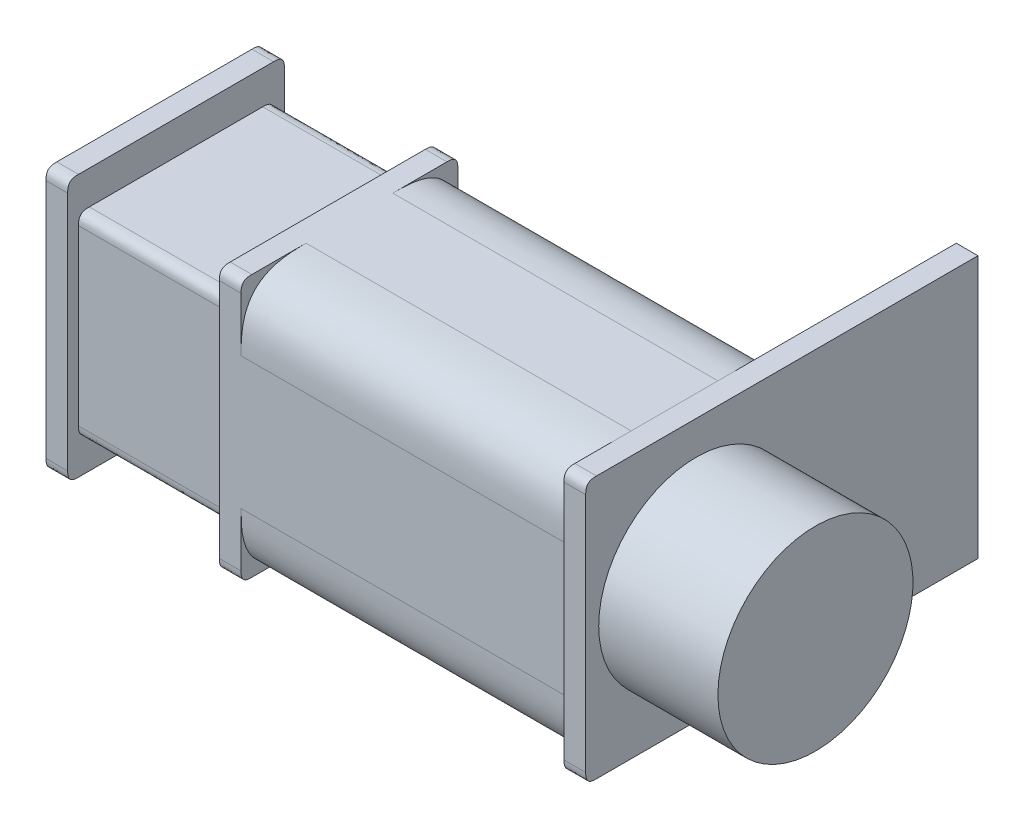
from build123d import *

# Parameters (mm, degrees)
BOSS_EXTRUDE1_DEPTH        = 5
BOSS_EXTRUDE1_DEPTH_BACK   = 5
SKETCH1_W                  = 1
SKETCH1_H                  = 12.1
BOSS_EXTRUDE1_2_DEPTH      = 5
BOSS_EXTRUDE1_2_DEPTH_BACK = 5
SKETCH1_W_2                = 15
FILLET1_START              = 9
FILLET1_OUTLINE_W          = 16
FILLET1_OUTLINE_H          = 14
FILLET1_DEPTH              = 17
FILLET2_SIZE               = 0.5
BOSS_EXTRUDE5_DEPTH        = 5
BOSS_EXTRUDE5_DEPTH_BACK   = 5
FILLET3_SIZE               = 0.5
BOSS_EXTRUDE3_START        = -4.5
BOSS_EXTRUDE3_OUTLINE_W    = 7
BOSS_EXTRUDE3_OUTLINE_H    = 9
BOSS_EXTRUDE3_DEPTH        = 9
FILLET5_SIZE               = 0.5
BOSS_EXTRUDE4_DEPTH        = 5.1
BOSS_EXTRUDE4_DEPTH_BACK   = 13
SKETCH1_5_W                = 1
SKETCH1_5_H                = 12.1
FILLET4_SIZE               = 0.5
SKETCH1_8_W                = 5.5
SKETCH1_8_H                = 4.5
SKETCH1_12_W               = 0.7
SKETCH1_12_H               = 0.5


with BuildPart() as part:
    # Sketch1 → Boss-Extrude1 (new, two sides: drawn at the far end of the back side and taken through both)
    with BuildSketch(Plane.XY.offset(-BOSS_EXTRUDE1_DEPTH_BACK)):
        with Locations((1.2, 0)):
            Rectangle(SKETCH1_W, SKETCH1_H)
    extrude(amount=BOSS_EXTRUDE1_DEPTH + BOSS_EXTRUDE1_DEPTH_BACK)

    # Fillet2
    # a fillet whose section is not a circle: 0.5 mm, written as the material it takes off along each edge
    with BuildSketch(Plane(origin=(2.95, 6.05, 5), x_dir=(0, 0, -1), z_dir=(-1, 0, 0)), Plane(origin=(2.95, 6.05, -5), x_dir=(0, -1, 0), z_dir=(-1, 0, 0)), Plane(origin=(-0.55, -6.05, 5), x_dir=(0, 0, -1), z_dir=(1, 0, 0))) as fillet2_piece_1:
        with BuildLine():
            add(Edge.make_bspline([(FILLET2_SIZE, 0), (FILLET2_SIZE * 0.831801948466, 0), (FILLET2_SIZE * 0.663603896932, 0), (FILLET2_SIZE * 0.292893218813, FILLET2_SIZE * 0.0716919198361), (FILLET2_SIZE * 0.0716919198361, FILLET2_SIZE * 0.292893218813), (0, FILLET2_SIZE * 0.663603896932), (0, FILLET2_SIZE * 0.831801948466), (0, FILLET2_SIZE)], knots=[0, 0, 0, 0, 0, 0, 0.5, 0.5, 1, 1, 1, 1, 1, 1], degree=5))
            Line((0, FILLET2_SIZE), (0, 0))
            Line((0, 0), (FILLET2_SIZE, 0))
        make_face()
    extrude(amount=3.5, mode=Mode.SUBTRACT)
    with BuildSketch(Plane(origin=(-0.55, -6.05, -5), x_dir=(0, 0, 1), z_dir=(1, 0, 0))) as fillet2_piece_2:
        with BuildLine():
            add(Edge.make_bspline([(FILLET2_SIZE, 0), (FILLET2_SIZE * 0.831801948466, 0), (FILLET2_SIZE * 0.663603896932, 0), (FILLET2_SIZE * 0.292893218813, -FILLET2_SIZE * 0.0716919198361), (FILLET2_SIZE * 0.0716919198361, -FILLET2_SIZE * 0.292893218813), (0, -FILLET2_SIZE * 0.663603896932), (0, -FILLET2_SIZE * 0.831801948466), (0, -FILLET2_SIZE)], knots=[0, 0, 0, 0, 0, 0, 0.5, 0.5, 1, 1, 1, 1, 1, 1], degree=5))
            Line((0, -FILLET2_SIZE), (0, 0))
            Line((0, 0), (FILLET2_SIZE, 0))
        make_face()
    extrude(amount=3.5, mode=Mode.SUBTRACT)

    # Boss-Extrude3: read off the stored shape, not the designer's step
    # Boss-Extrude3 outline → Boss-Extrude3 (add)
    with BuildSketch(Plane.XY.offset(BOSS_EXTRUDE3_START)):
        with Locations((5.2, 0)):
            Rectangle(BOSS_EXTRUDE3_OUTLINE_W, BOSS_EXTRUDE3_OUTLINE_H)
    extrude(amount=BOSS_EXTRUDE3_DEPTH)

    # Fillet5
    # a fillet whose section is not a circle: 0.5 mm, written as the material it takes off along each edge
    with BuildSketch(Plane(origin=(9.95, 4.5, -4.5), x_dir=(0, -1, 0), z_dir=(-1, 0, 0)), Plane(origin=(1.7, -4.5, -4.5), x_dir=(0, 1, 0), z_dir=(1, 0, 0)), Plane(origin=(1.7, -4.5, 4.5), x_dir=(0, 0, -1), z_dir=(1, 0, 0))) as fillet5_piece_1:
        with BuildLine():
            add(Edge.make_bspline([(FILLET5_SIZE, 0), (FILLET5_SIZE * 0.831801948466, 0), (FILLET5_SIZE * 0.663603896932, 0), (FILLET5_SIZE * 0.292893218813, FILLET5_SIZE * 0.0716919198361), (FILLET5_SIZE * 0.0716919198361, FILLET5_SIZE * 0.292893218813), (0, FILLET5_SIZE * 0.663603896932), (0, FILLET5_SIZE * 0.831801948466), (0, FILLET5_SIZE)], knots=[0, 0, 0, 0, 0, 0, 0.5, 0.5, 1, 1, 1, 1, 1, 1], degree=5))
            Line((0, FILLET5_SIZE), (0, 0))
            Line((0, 0), (FILLET5_SIZE, 0))
        make_face()
    extrude(amount=8.25, mode=Mode.SUBTRACT)
    with BuildSketch(Plane(origin=(9.95, 4.5, 4.5), x_dir=(0, -1, 0), z_dir=(-1, 0, 0))) as fillet5_piece_2:
        with BuildLine():
            add(Edge.make_bspline([(FILLET5_SIZE, 0), (FILLET5_SIZE * 0.831801948466, 0), (FILLET5_SIZE * 0.663603896932, 0), (FILLET5_SIZE * 0.292893218813, -FILLET5_SIZE * 0.0716919198361), (FILLET5_SIZE * 0.0716919198361, -FILLET5_SIZE * 0.292893218813), (0, -FILLET5_SIZE * 0.663603896932), (0, -FILLET5_SIZE * 0.831801948466), (0, -FILLET5_SIZE)], knots=[0, 0, 0, 0, 0, 0, 0.5, 0.5, 1, 1, 1, 1, 1, 1], degree=5))
            Line((0, -FILLET5_SIZE), (0, 0))
            Line((0, 0), (FILLET5_SIZE, 0))
        make_face()
    extrude(amount=8.25, mode=Mode.SUBTRACT)

    # Sketch1<12> → Revolve3 (revolve)
    with BuildSketch(Plane.XY, mode=Mode.PRIVATE) as revolve3_sk:
        with Locations((0.35, 2.25)):
            Rectangle(SKETCH1_12_W, SKETCH1_12_H)
    revolve(revolve3_sk.sketch.rotate(Axis((0, 0, 0), (1, 0, 0)), 90), axis=Axis((0, 0, 0), (1, 0, 0)))


with BuildPart() as body_2:
    # Sketch1 → Boss-Extrude1 2 (new, two sides: drawn at the far end of the back side and taken through both)
    with BuildSketch(Plane.XY.offset(-BOSS_EXTRUDE1_2_DEPTH_BACK)):
        with Locations((17.2, 0)):
            Rectangle(SKETCH1_W_2, SKETCH1_H)
    extrude(amount=BOSS_EXTRUDE1_2_DEPTH + BOSS_EXTRUDE1_2_DEPTH_BACK)

    # Fillet1: read off the stored shape, not the designer's step
    # Fillet1 outline → Fillet1 (cut)
    # profile 1 of 3: a face of its own
    with BuildSketch(Plane.YZ.offset(FILLET1_START)):
        Rectangle(FILLET1_OUTLINE_W, FILLET1_OUTLINE_H)
        with BuildLine():
            Line((3.05, -5), (-3.05, -5))
            Line((-3.05, -5), (-6.05, -5))
            Line((-6.05, -5), (-6.05, -2))
            Line((-6.05, -2), (-6.05, 2))
            Line((-6.05, 2), (-6.05, 5))
            Line((-6.05, 5), (-3.05, 5))
            Line((-3.05, 5), (3.05, 5))
            add(Edge.make_bspline(
                [(3.05, 5), (3.554594155, 5), (4.059188309, 5), (5.171320344, 4.78492424), (5.83492424, 4.121320344), (6.05, 3.009188309), (6.05, 2.504594155), (6.05, 2)],
                knots=[0, 0, 0, 0, 0, 0, 0.5, 0.5, 1, 1, 1, 1, 1, 1], degree=5))
            Line((6.05, 2), (6.05, -2))
            add(Edge.make_bspline(
                [(3.05, -5), (3.554594155, -5), (4.059188309, -5), (5.171320344, -4.78492424), (5.83492424, -4.121320344), (6.05, -3.009188309), (6.05, -2.504594155), (6.05, -2)],
                knots=[0, 0, 0, 0, 0, 0, 0.5, 0.5, 1, 1, 1, 1, 1, 1], degree=5))
        make_face(mode=Mode.SUBTRACT)
    # profile 2 of 3: a face of its own
    with BuildSketch(Plane.YZ.offset(FILLET1_START)):
        with BuildLine():
            Line((-6.05, 5), (-6.05, 2))
            add(Edge.make_bspline(
                [(-3.05, 5), (-3.554594155, 5), (-4.059188309, 5), (-5.171320344, 4.78492424), (-5.83492424, 4.121320344), (-6.05, 3.009188309), (-6.05, 2.504594155), (-6.05, 2)],
                knots=[0, 0, 0, 0, 0, 0, 0.5, 0.5, 1, 1, 1, 1, 1, 1], degree=5))
            Line((-3.05, 5), (-6.05, 5))
        make_face()
    # profile 3 of 3: a face of its own
    with BuildSketch(Plane.YZ.offset(FILLET1_START)):
        with BuildLine():
            Line((-6.05, -5), (-3.05, -5))
            add(Edge.make_bspline(
                [(-3.05, -5), (-3.554594155, -5), (-4.059188309, -5), (-5.171320344, -4.78492424), (-5.83492424, -4.121320344), (-6.05, -3.009188309), (-6.05, -2.504594155), (-6.05, -2)],
                knots=[0, 0, 0, 0, 0, 0, 0.5, 0.5, 1, 1, 1, 1, 1, 1], degree=5))
            Line((-6.05, -2), (-6.05, -5))
        make_face()
    extrude(amount=FILLET1_DEPTH, mode=Mode.SUBTRACT)

    # Sketch1<13> → Boss-Extrude5 (add, two sides: drawn at the far end of the back side and taken through both)
    with BuildSketch(Plane.XY.offset(-BOSS_EXTRUDE5_DEPTH_BACK)):
        Polygon((8.7, 4.5), (8.7, 0), (9.7, 0), (9.7, 6.05), (8.7, 6.05), align=None)
        Polygon((9.7, 0), (8.7, 0), (8.7, -4.5), (8.7, -6.05), (9.7, -6.05), align=None)
    extrude(amount=BOSS_EXTRUDE5_DEPTH + BOSS_EXTRUDE5_DEPTH_BACK)

    # Fillet3
    # a fillet whose section is not a circle: 0.5 mm, written as the material it takes off along each edge
    with BuildSketch(Plane(origin=(10.95, 6.05, -5), x_dir=(0, 0, 1), z_dir=(-1, 0, 0)), Plane(origin=(7.45, -6.05, 5), x_dir=(0, 1, 0), z_dir=(1, 0, 0)), Plane(origin=(7.45, -6.05, -5), x_dir=(0, 0, 1), z_dir=(1, 0, 0))) as fillet3_piece_1:
        with BuildLine():
            add(Edge.make_bspline([(FILLET3_SIZE, 0), (FILLET3_SIZE * 0.831801948466, 0), (FILLET3_SIZE * 0.663603896932, 0), (FILLET3_SIZE * 0.292893218813, -FILLET3_SIZE * 0.0716919198361), (FILLET3_SIZE * 0.0716919198361, -FILLET3_SIZE * 0.292893218813), (0, -FILLET3_SIZE * 0.663603896932), (0, -FILLET3_SIZE * 0.831801948466), (0, -FILLET3_SIZE)], knots=[0, 0, 0, 0, 0, 0, 0.5, 0.5, 1, 1, 1, 1, 1, 1], degree=5))
            Line((0, -FILLET3_SIZE), (0, 0))
            Line((0, 0), (FILLET3_SIZE, 0))
        make_face()
    extrude(amount=3.5, mode=Mode.SUBTRACT)
    with BuildSketch(Plane(origin=(10.95, 6.05, 5), x_dir=(0, 0, -1), z_dir=(-1, 0, 0))) as fillet3_piece_2:
        with BuildLine():
            add(Edge.make_bspline([(FILLET3_SIZE, 0), (FILLET3_SIZE * 0.831801948466, 0), (FILLET3_SIZE * 0.663603896932, 0), (FILLET3_SIZE * 0.292893218813, FILLET3_SIZE * 0.0716919198361), (FILLET3_SIZE * 0.0716919198361, FILLET3_SIZE * 0.292893218813), (0, FILLET3_SIZE * 0.663603896932), (0, FILLET3_SIZE * 0.831801948466), (0, FILLET3_SIZE)], knots=[0, 0, 0, 0, 0, 0, 0.5, 0.5, 1, 1, 1, 1, 1, 1], degree=5))
            Line((0, FILLET3_SIZE), (0, 0))
            Line((0, 0), (FILLET3_SIZE, 0))
        make_face()
    extrude(amount=3.5, mode=Mode.SUBTRACT)


with BuildPart() as body_3:
    # Sketch1<5> → Boss-Extrude4 (new, two sides: drawn at the far end of the back side and taken through both)
    with BuildSketch(Plane.XY.offset(-BOSS_EXTRUDE4_DEPTH_BACK)):
        with Locations((25.2, 0)):
            Rectangle(SKETCH1_5_W, SKETCH1_5_H)
    extrude(amount=BOSS_EXTRUDE4_DEPTH + BOSS_EXTRUDE4_DEPTH_BACK)

    # Fillet4
    # a fillet whose section is not a circle: 0.5 mm, written as the material it takes off along each edge
    with BuildSketch(Plane(origin=(23.45, -6.05, 5.1), x_dir=(0, 0, -1), z_dir=(1, 0, 0)), Plane(origin=(26.95, 6.05, 5.1), x_dir=(0, 0, -1), z_dir=(-1, 0, 0))) as fillet4_piece_1:
        with BuildLine():
            add(Edge.make_bspline([(FILLET4_SIZE, 0), (FILLET4_SIZE * 0.831801948466, 0), (FILLET4_SIZE * 0.663603896932, 0), (FILLET4_SIZE * 0.292893218813, FILLET4_SIZE * 0.0716919198361), (FILLET4_SIZE * 0.0716919198361, FILLET4_SIZE * 0.292893218813), (0, FILLET4_SIZE * 0.663603896932), (0, FILLET4_SIZE * 0.831801948466), (0, FILLET4_SIZE)], knots=[0, 0, 0, 0, 0, 0, 0.5, 0.5, 1, 1, 1, 1, 1, 1], degree=5))
            Line((0, FILLET4_SIZE), (0, 0))
            Line((0, 0), (FILLET4_SIZE, 0))
        make_face()
    extrude(amount=3.5, mode=Mode.SUBTRACT)


with BuildPart() as body_4:
    # Sketch1<8> → Revolve1 (revolve)
    with BuildSketch(Plane.XY, mode=Mode.PRIVATE) as revolve1_sk:
        with Locations((28.45, 2.25)):
            Rectangle(SKETCH1_8_W, SKETCH1_8_H)
    revolve(revolve1_sk.sketch.rotate(Axis((0, 0, 0), (1, 0, 0)), 90), axis=Axis((0, 0, 0), (1, 0, 0)))


solid = Compound([part.part, body_2.part, body_3.part, body_4.part])
